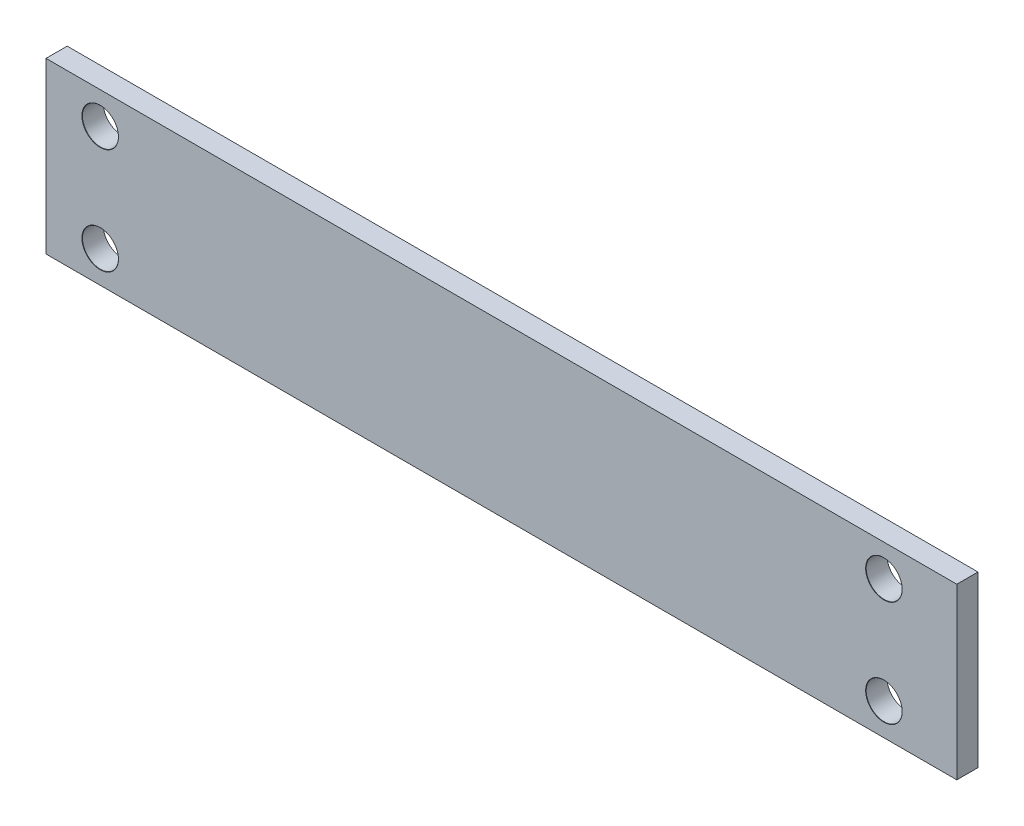
from build123d import *

# Parameters (mm, degrees)
SKETCH1_W                      = 86
SKETCH1_H                      = 16
BOSS_EXTRUDE1_DEPTH            = 2
M3_CLEARANCE_HOLE1_D           = 3.4
M3_CLEARANCE_HOLE1_CSINK_D     = 3.45
M3_CLEARANCE_HOLE1_CSINK_ANGLE = 90


with BuildPart() as part:
    # Sketch1 → Boss-Extrude1 (new body)
    with BuildSketch(Plane.XY):
        with Locations((43, 8)):
            Rectangle(SKETCH1_W, SKETCH1_H)
    extrude(amount=BOSS_EXTRUDE1_DEPTH)

    # M3 Clearance Hole1 (through all)
    with Locations(Plane.XY.offset(2)):
        with Locations((5.115834522, 13), (5.115834522, 3), (79.115834522, 13), (79.115834522, 3)):
            CounterSinkHole(M3_CLEARANCE_HOLE1_D / 2, M3_CLEARANCE_HOLE1_CSINK_D / 2, counter_sink_angle=M3_CLEARANCE_HOLE1_CSINK_ANGLE)


solid = part.part
